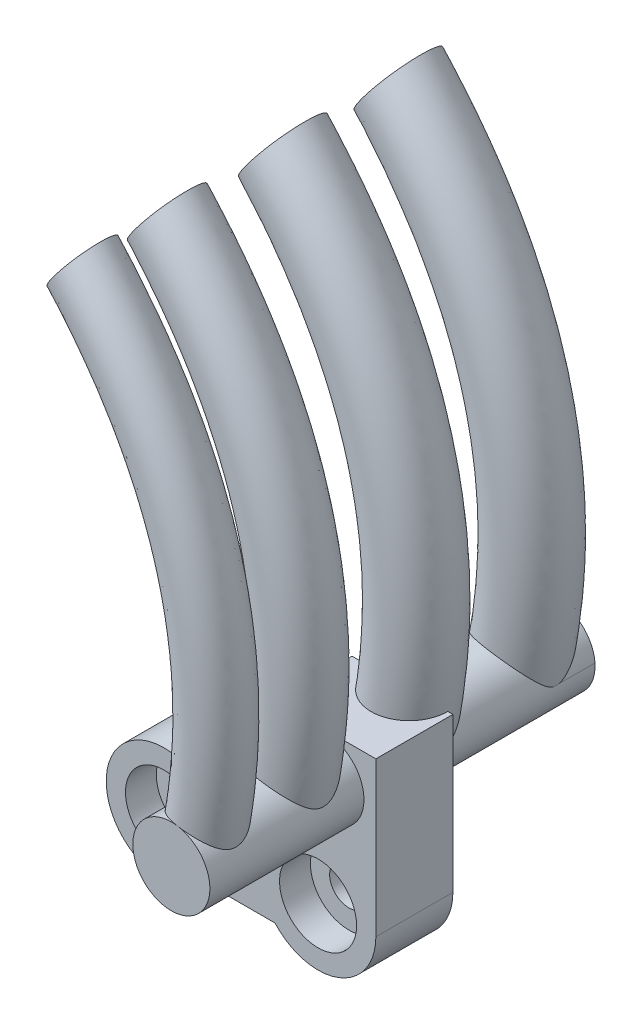
from build123d import *

# Parameters (mm, degrees)
SKETCH1_R           = 1.5
SKETCH1_R_2         = 2.5
BOSS_EXTRUDE1_DEPTH = 5
SKETCH2_R           = 5
CUT_EXTRUDE1_DEPTH  = 4
CUT_EXTRUDE3_START  = -4
SKETCH5_R           = 5
CUT_EXTRUDE3_DEPTH  = 4
BOSS_EXTRUDE2_START = -10
BOSS_EXTRUDE2_DEPTH = 10
SKETCH7_R           = 5
BOSS_EXTRUDE3_DEPTH = 25
SKETCH8_R           = 5
SKETCH8_R_2         = 4.5
SKETCH8_R_3         = 4
SKETCH10_R          = 5
CUT_EXTRUDE4_DEPTH  = 4


with BuildPart() as part:
    # Sketch1 → Boss-Extrude1 (new, symmetric)
    with BuildSketch(Plane.XY):
        with BuildLine():
            Line((-4.409830056, -5), (4.409830056, -5))
            ThreePointArc((4.409830056, -5), (17.5, 0), (4.409830056, 5))
            Line((4.409830056, 5), (-4.409830056, 5))
            ThreePointArc((-4.409830056, 5), (-17.5, 0), (-4.409830056, -5))
        make_face()
        with Locations((-10, 0)):
            Circle(SKETCH1_R, mode=Mode.SUBTRACT)
        with Locations((10, 0)):
            Circle(SKETCH1_R_2, mode=Mode.SUBTRACT)
    extrude(amount=BOSS_EXTRUDE1_DEPTH, both=True)

    # Sketch2 → Cut-Extrude1 (cut)
    with BuildSketch(Plane.XY.offset(5)):
        with Locations((10, 0)):
            Circle(SKETCH2_R)
    extrude(amount=-CUT_EXTRUDE1_DEPTH, mode=Mode.SUBTRACT)

    # Sketch5 → Cut-Extrude3 (cut)
    with BuildSketch(Plane(origin=(0, 0, -5), x_dir=(-1, 0, 0), z_dir=(0, 0, -1)).offset(CUT_EXTRUDE3_START)):
        with Locations((-10, 0)):
            Circle(SKETCH5_R)
    extrude(amount=CUT_EXTRUDE3_DEPTH, mode=Mode.SUBTRACT)

    # Sketch6 → Boss-Extrude2 (add)
    with BuildSketch(Plane(origin=(0, 0, -5), x_dir=(-1, 0, 0), z_dir=(0, 0, -1)).offset(BOSS_EXTRUDE2_START)):
        with BuildLine():
            Line((-17.5, 20), (-17.5, 0))
            ThreePointArc((-17.5, 0), (-12.676165673, 7.006292692), (-4.409830056, 5))
            Line((-4.409830056, 5), (-4.409830056, 20))
            Line((-4.409830056, 20), (-17.5, 20))
        make_face()
    extrude(amount=BOSS_EXTRUDE2_DEPTH)

    # Sketch7 → Boss-Extrude3 (add, symmetric)
    with BuildSketch(Plane.XY):
        with Locations((10.954915028, 14.645828645)):
            Circle(SKETCH7_R)
    extrude(amount=BOSS_EXTRUDE3_DEPTH, both=True)

    # Sweep1: sweep along a path in Sketch9
    with BuildLine() as sweep1_path:  # in the path sketch's own coordinates; laid on its plane below (add() does not lay a ready-made edge on the line's plane)
        add(Edge.make_bspline(
            [(10.954915028, 15), (18.238943146, 47.876881482), (-4.574227678, 72.955549577)],
            knots=[0, 0, 0, 1, 1, 1], degree=2))
    # Sketch8 → Sweep1 (sweep)
    with BuildSketch(Plane(origin=(0, 15, 0), x_dir=(1, 0, 0), z_dir=(0, 1, 0))):
        with Locations((10.954915028, 20)):
            Circle(SKETCH8_R)
        with Locations((10.954915028, 5)):
            Circle(SKETCH8_R)
        with Locations((10.954915028, -10)):
            Circle(SKETCH8_R_2)
        with Locations((10.954915028, -21)):
            Circle(SKETCH8_R_3)
    sweep(path=Plane.XY * sweep1_path.line)

    # Sketch10 → Cut-Extrude4 (cut)
    with BuildSketch(Plane.XY.offset(5)):
        with Locations((-10, 0)):
            Circle(SKETCH10_R)
    extrude(amount=-CUT_EXTRUDE4_DEPTH, mode=Mode.SUBTRACT)


solid = part.part
